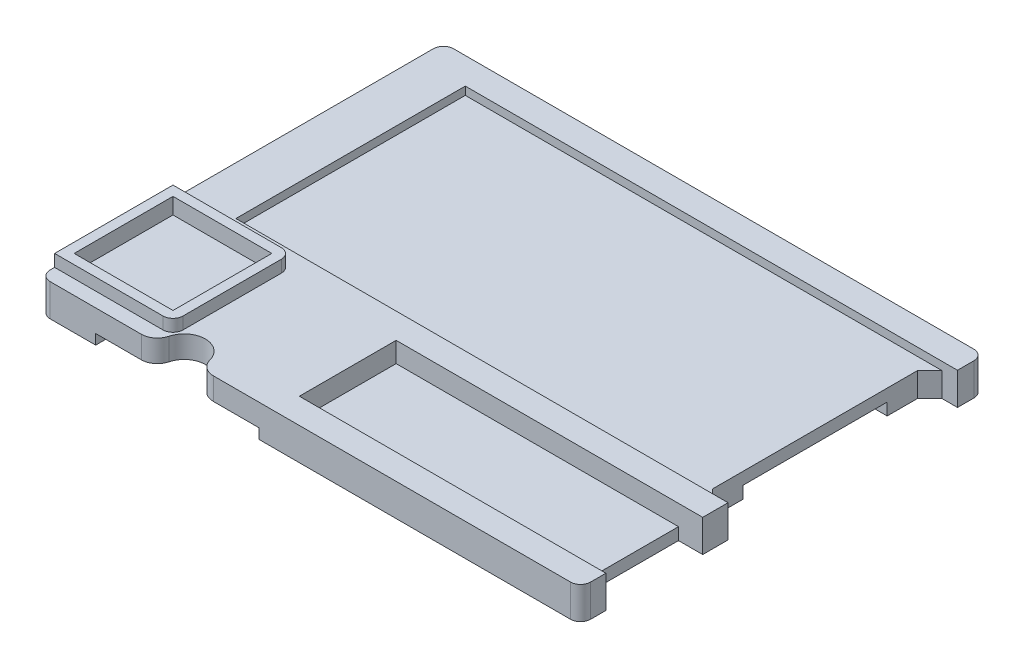
from build123d import *

# Parameters (mm, degrees)
SKETCH1_W               = 67
SKETCH1_H               = 35
BOSS_EXTRUDE1_DEPTH     = 4
CUT_EXTRUDE1_DEPTH      = 1
SKETCH3_W               = 67
SKETCH3_H               = 15
BOSS_EXTRUDE2_DEPTH     = 4
SKETCH4_W               = 38
SKETCH4_H               = 12
CUT_EXTRUDE2_DEPTH      = 10
SKETCH7_W               = 3.441650955
SKETCH7_H               = 28.44
CUT_EXTRUDE3_DEPTH      = 10
CHAMFER1_SIZE           = 1.5
CUT_EXTRUDE4_DEPTH      = 1.5
SKETCH5_W               = 35
SKETCH5_H               = 12
BOSS_EXTRUDE4_DEPTH     = 1.5
SKETCH9_R               = 1.925
SKETCH9_W               = 20.25
SKETCH9_H               = 20.25
CUT_EXTRUDE5_DEPTH      = 1.25
CUT_EXTRUDE6_DEPTH      = 6.6
CUT_EXTRUDE6_DEPTH_BACK = 6.6
SKETCH10_R              = 2.625
FILLET4_R               = 2
SKETCH11_W              = 12.25
SKETCH11_H              = 12.25
CUT_EXTRUDE8_DEPTH      = 0.5
SKETCH13_W              = 14.674904748
SKETCH13_H              = 14.674904748
SKETCH13_W_2            = 12.25
SKETCH13_H_2            = 12.25
BOSS_EXTRUDE5_DEPTH     = 1.5
FILLET5_R               = 1.25
FILLET6_R               = 1.25
SKETCH14_W              = 20.25
SKETCH14_H              = 1.651849009
CUT_EXTRUDE9_DEPTH      = 1.5


with BuildPart() as part:
    # Sketch1 → Boss-Extrude1 (new body)
    with BuildSketch(Plane(origin=(0, 0, 0), x_dir=(1, 0, 0), z_dir=(0, 1, 0))):
        Rectangle(SKETCH1_W, SKETCH1_H)
    extrude(amount=BOSS_EXTRUDE1_DEPTH)

    # Sketch2 → Cut-Extrude1 (cut)
    with BuildSketch(Plane(origin=(0, 4, 0), x_dir=(1, 0, 0), z_dir=(0, 1, 0))):
        Polygon((-27.51, 14.22), (27.419266745, 14.22), (33.5, 14.22), (33.5, -14.22), (30.165301507, -14.22), (-27.51, -14.22), align=None)
    extrude(amount=-CUT_EXTRUDE1_DEPTH, mode=Mode.SUBTRACT)

    # Sketch3 → Boss-Extrude2 (add)
    with BuildSketch(Plane(origin=(0, 4, 0), x_dir=(1, 0, 0), z_dir=(0, 1, 0))):
        with Locations((0, -25)):
            Rectangle(SKETCH3_W, SKETCH3_H)
    extrude(amount=-BOSS_EXTRUDE2_DEPTH)

    # Sketch4 → Cut-Extrude2 (cut)
    with BuildSketch(Plane(origin=(0, 4, 0), x_dir=(1, 0, 0), z_dir=(0, 1, 0))):
        with Locations((14.5, -23.36)):
            Rectangle(SKETCH4_W, SKETCH4_H)
    extrude(amount=-CUT_EXTRUDE2_DEPTH, mode=Mode.SUBTRACT)

    # Sketch7 → Cut-Extrude3 (cut)
    with BuildSketch(Plane(origin=(0, 3, 0), x_dir=(1, 0, 0), z_dir=(0, 1, 0))):
        with Locations((31.779174522, 0)):
            Rectangle(SKETCH7_W, SKETCH7_H)
    extrude(amount=-CUT_EXTRUDE3_DEPTH, mode=Mode.SUBTRACT)

    # Chamfer1
    chamfer1_edges = [part.edges().sort_by_distance(p)[0] for p in [
        (30.058349045, 1.5, 14.22),
        (30.058349045, 1.5, -14.22),
    ]]
    chamfer(chamfer1_edges, length=CHAMFER1_SIZE)

    # Sketch8 → Cut-Extrude4 (cut)
    with BuildSketch(Plane.XZ):
        with BuildLine():
            Line((30.058349045, 8.95), (1.508349045, 8.95))
            Line((1.508349045, 8.95), (1.508349045, 6.432050808))
            ThreePointArc((1.508349045, 6.432050808), (2.903992969, 6.022875656), (3.508349045, 4.7))
            Line((3.508349045, 4.7), (3.508349045, -4.7))
            ThreePointArc((3.508349045, -4.7), (2.903992969, -6.022875656), (1.508349045, -6.432050808))
            Line((1.508349045, -6.432050808), (1.508349045, -8.95))
            Line((1.508349045, -8.95), (30.058349045, -8.95))
            Line((30.058349045, -8.95), (30.058349045, 8.95))
        make_face()
    extrude(amount=-CUT_EXTRUDE4_DEPTH, mode=Mode.SUBTRACT)

    # Sketch5 → Boss-Extrude4 (add)
    with BuildSketch(Plane.XZ):
        with Locations((13, 23.36)):
            Rectangle(SKETCH5_W, SKETCH5_H)
    extrude(amount=-BOSS_EXTRUDE4_DEPTH)

    # Sketch9 → Cut-Extrude5 (cut)
    with BuildSketch(Plane.XZ):
        with Locations((-6.354971576, 21.536411907)):
            Circle(SKETCH9_R)
        with Locations((-26.604971576, 21.536411907)):
            Circle(SKETCH9_R)
        with Locations((-16.479971576, 21.536411907)):
            Rectangle(SKETCH9_W, SKETCH9_H)
        with BuildLine():
            ThreePointArc((-24.679971576, 21.536411907), (-25.243791022, 22.897592461), (-26.604971576, 23.461411907))
            Line((-26.604971576, 23.461411907), (-26.604971576, 19.611411907))
            ThreePointArc((-26.604971576, 19.611411907), (-25.243791022, 20.175231353), (-24.679971576, 21.536411907))
        make_face()
        with BuildLine():
            Line((-26.604971576, 19.611411907), (-26.604971576, 23.461411907))
            ThreePointArc((-26.604971576, 23.461411907), (-28.529971576, 21.536411907), (-26.604971576, 19.611411907))
        make_face()
        with BuildLine():
            ThreePointArc((-4.429971576, 21.536411907), (-4.993791022, 22.897592461), (-6.354971576, 23.461411907))
            Line((-6.354971576, 23.461411907), (-6.354971576, 19.611411907))
            ThreePointArc((-6.354971576, 19.611411907), (-4.993791022, 20.175231353), (-4.429971576, 21.536411907))
        make_face()
        with BuildLine():
            Line((-6.354971576, 19.611411907), (-6.354971576, 23.461411907))
            ThreePointArc((-6.354971576, 23.461411907), (-8.279971576, 21.536411907), (-6.354971576, 19.611411907))
        make_face()
    extrude(amount=-CUT_EXTRUDE5_DEPTH, mode=Mode.SUBTRACT)

    # Sketch10 → Cut-Extrude6 (cut, two sides: drawn at the far end of the back side and taken through both)
    with BuildSketch(Plane.XZ.offset(-1.25).offset(-CUT_EXTRUDE6_DEPTH_BACK)):
        with Locations((-16.479971576, 31.661411907)):
            Circle(SKETCH10_R)
    extrude(amount=CUT_EXTRUDE6_DEPTH + CUT_EXTRUDE6_DEPTH_BACK, mode=Mode.SUBTRACT)

    # Fillet4
    fillet4_edges = [part.edges().sort_by_distance(p)[0] for p in [
        (-18.967419065, 2, 32.5),
        (-13.992524087, 2, 32.5),
    ]]
    fillet(fillet4_edges, radius=FILLET4_R)

    # Sketch11 → Cut-Extrude8 (cut)
    with BuildSketch(Plane(origin=(0, 4, 0), x_dir=(1, 0, 0), z_dir=(0, 1, 0))):
        with Locations((-26.162547626, -23.36)):
            Rectangle(SKETCH11_W, SKETCH11_H)
    extrude(amount=-CUT_EXTRUDE8_DEPTH, mode=Mode.SUBTRACT)

    # Sketch13 → Boss-Extrude5 (add)
    with BuildSketch(Plane(origin=(0, 4, 0), x_dir=(1, 0, 0), z_dir=(0, 1, 0))):
        with Locations((-26.162547626, -23.36)):
            Rectangle(SKETCH13_W, SKETCH13_H)
        with Locations((-26.162547626, -23.36)):
            Rectangle(SKETCH13_W_2, SKETCH13_H_2, mode=Mode.SUBTRACT)
    extrude(amount=BOSS_EXTRUDE5_DEPTH)

    # Fillet5
    # the kernel refuses this fillet: 1.25 mm, written as the material it takes off along each edge
    with BuildSketch(Plane(origin=(-18.825095252, 4, 16.022547626), x_dir=(0, 0, 1), z_dir=(0, 1, 0)), Plane(origin=(-18.825095252, 4, 30.697452374), x_dir=(-1, 0, 0), z_dir=(0, 1, 0))) as fillet5_piece_1:
        with BuildLine():
            CenterArc((FILLET5_R, -FILLET5_R), FILLET5_R, 90, 90)
            Line((0, -FILLET5_R), (0, 0))
            Line((0, 0), (FILLET5_R, 0))
        make_face()
    extrude(amount=4.625, mode=Mode.SUBTRACT)

    # Fillet6
    fillet6_edges = [part.edges().sort_by_distance(p)[0] for p in [
        (-33.5, 2, 32.5),
        (33.5, 2, 32.5),
        (-33.5, 2, -17.5),
        (33.5, 2, -17.5),
    ]]
    fillet(fillet6_edges, radius=FILLET6_R)

    # Sketch14 → Cut-Extrude9 (cut)
    with BuildSketch(Plane.XZ.offset(-1.25)):
        with Locations((-16.479971576, 32.487336412)):
            Rectangle(SKETCH14_W, SKETCH14_H)
    extrude(amount=CUT_EXTRUDE9_DEPTH, mode=Mode.SUBTRACT)


solid = part.part
